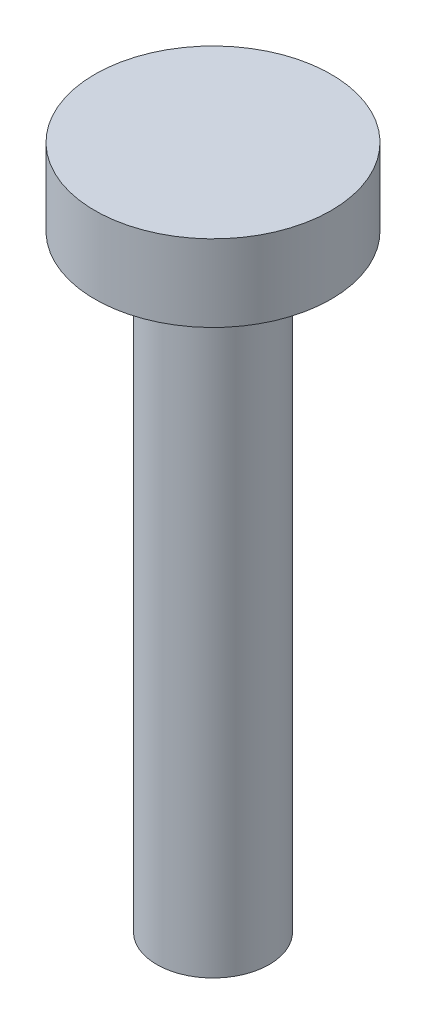
from build123d import *

# Parameters (mm, degrees)
REVOLVE1_ANGLE = 359.999695921


with BuildPart() as part:
    # Sketch1 → Revolve1 (revolve)
    with BuildSketch(Plane.XY):
        Polygon((0, 0), (4.7625, 0), (4.7625, 51.4), (10, 51.4), (10, 57.9), (0, 57.9), align=None)
    revolve(axis=Axis((0, 0, 0), (0, 1, 0)), revolution_arc=REVOLVE1_ANGLE)


solid = part.part
